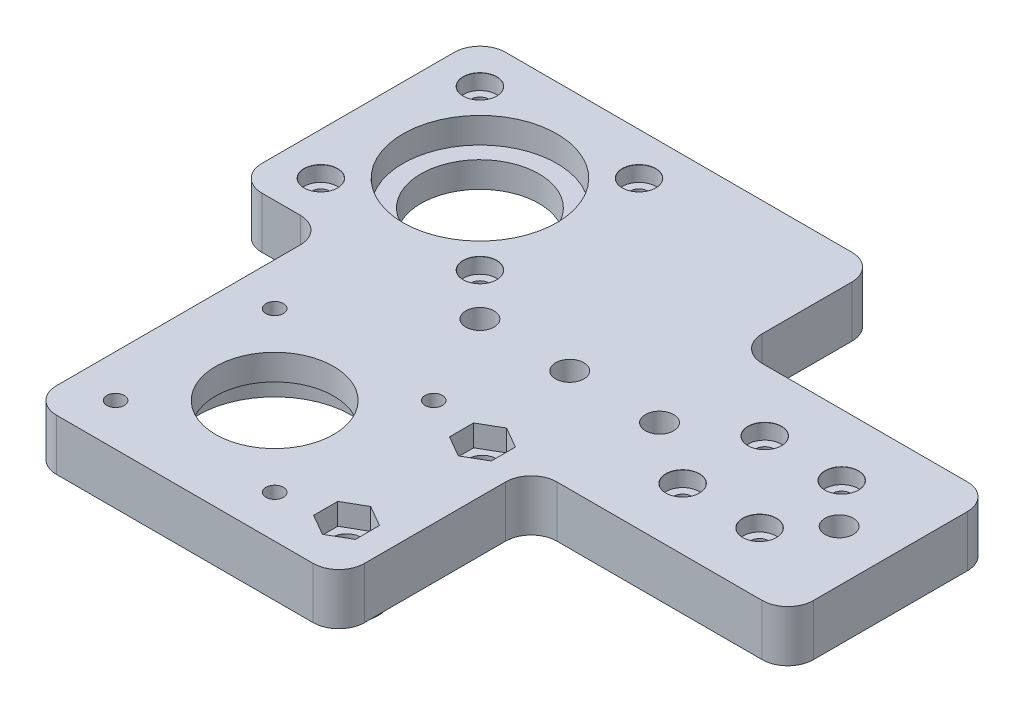
from build123d import *

# Parameters (mm, degrees)
BOSS_EXTRUDE1_DEPTH            = 10
FILLET1_R                      = 5
SKETCH3_R                      = 11.5
CUT_EXTRUDE1_DEPTH             = 10
CBORE_FOR_M3_SHCS1_AT_2_COUNT  = 2
CBORE_FOR_M3_SHCS1_AT_2_PITCH  = 43.840620434
CBORE_FOR_M3_SHCS1_AT_3_COUNT  = 2
CBORE_FOR_M3_SHCS1_AT_3_PITCH  = 31
CBORE_FOR_M3_SHCS1_AT_4_COUNT  = 2
CBORE_FOR_M3_SHCS1_AT_4_PITCH  = 31
CBORE_FOR_M3_SHCS2_AT_2_COUNT  = 2
CBORE_FOR_M3_SHCS2_AT_2_PITCH  = 15
CBORE_FOR_M3_SHCS2_AT_3_COUNT  = 2
CBORE_FOR_M3_SHCS2_AT_3_PITCH  = 21.931712199
CBORE_FOR_M3_SHCS2_AT_4_COUNT  = 2
CBORE_FOR_M3_SHCS2_AT_4_PITCH  = 16
CBORE_FOR_M5_SHCS1_AT_2_COUNT  = 2
CBORE_FOR_M5_SHCS1_AT_2_PITCH  = 35
CBORE_FOR_M5_SHCS1_AT_3_COUNT  = 2
CBORE_FOR_M5_SHCS1_AT_3_PITCH  = 52.5
CBORE_FOR_M5_SHCS1_AT_4_COUNT  = 2
CBORE_FOR_M5_SHCS1_AT_4_PITCH  = 70
BOSS_EXTRUDE2_DEPTH            = 10
CUT_EXTRUDE2_DEPTH             = 10
FILLET2_R                      = 5
SKETCH16_R                     = 11.5
CUT_EXTRUDE3_DEPTH             = 125.524094054
CBORE_FOR_M3_SHCS3_AT_2_COUNT  = 2
CBORE_FOR_M3_SHCS3_AT_2_PITCH  = 31
CBORE_FOR_M3_SHCS3_AT_3_COUNT  = 2
CBORE_FOR_M3_SHCS3_AT_3_PITCH  = 43.840620434
CBORE_FOR_M3_SHCS3_AT_4_COUNT  = 2
CBORE_FOR_M3_SHCS3_AT_4_PITCH  = 31
CUT_EXTRUDE4_DEPTH             = 4.2
M5_CLEARANCE_HOLE1_D           = 5.5
M5_CLEARANCE_HOLE1_CSINK_D     = 5.55
M5_CLEARANCE_HOLE1_CSINK_ANGLE = 90
SKETCH24_R                     = 15
CUT_EXTRUDE5_DEPTH             = 5
SKETCH25_R                     = 15
CUT_EXTRUDE6_DEPTH             = 5
BOSS_EXTRUDE3_START            = 2.9
SKETCH26_R                     = 6.25
SKETCH26_R_2                   = 2.75
BOSS_EXTRUDE3_DEPTH            = 2.9


with BuildPart() as part:
    # Sketch1 → Boss-Extrude1 (new body)
    with BuildSketch(Plane(origin=(0, 0, 0), x_dir=(1, 0, 0), z_dir=(0, 1, 0))):
        Polygon((0, 67.5), (0, -47.5), (60, -47.5), (60, -10), (110, -10), (110, 30), (60, 30), (60, 67.5), align=None)
    extrude(amount=BOSS_EXTRUDE1_DEPTH)

    # Fillet1
    fillet1_edges = [part.edges().sort_by_distance(p)[0] for p in [
        (60, 5, -30),
        (110, 5, -30),
        (110, 5, 10),
        (60, 5, 10),
        (0, 5, 47.5),
        (0, 5, -67.5),
        (60, 5, -67.5),
        (60, 5, 47.5),
    ]]
    fillet(fillet1_edges, radius=FILLET1_R)

    # Sketch3 → Cut-Extrude1 (cut)
    with BuildSketch(Plane(origin=(0, 10, 0), x_dir=(1, 0, 0), z_dir=(0, 1, 0))):
        with Locations((23.75, -23.75)):
            Circle(SKETCH3_R)
    extrude(amount=-CUT_EXTRUDE1_DEPTH, mode=Mode.SUBTRACT)

    # Sketch6 → CBORE for M3 SHCS1 (revolve, cut)
    with BuildSketch(Plane(origin=(39.25, 0, 8.25), x_dir=(0, 0, -1), z_dir=(1, 0, 0))):
        Polygon((0, 0), (0, 10), (1.7, 10), (1.7, 3), (3.25, 3), (3.25, 0.025), (3.275, 0), align=None)
    cbore_for_m3_shcs1 = revolve(axis=Axis((39.25, -6.35, 8.25), (0, 1, 0)), mode=Mode.SUBTRACT)

    # CBORE for M3 SHCS1 at 2: CBORE for M3 SHCS1 ×2
    with Locations(*[Vector(-0.7071067811865478, 0, 0.7071067811865474) * (i * CBORE_FOR_M3_SHCS1_AT_2_PITCH) for i in range(1, CBORE_FOR_M3_SHCS1_AT_2_COUNT)]):
        add(cbore_for_m3_shcs1, mode=Mode.SUBTRACT)

    # CBORE for M3 SHCS1 at 3: CBORE for M3 SHCS1 ×2
    with Locations(*[(-i * CBORE_FOR_M3_SHCS1_AT_3_PITCH, 0, 0) for i in range(1, CBORE_FOR_M3_SHCS1_AT_3_COUNT)]):
        add(cbore_for_m3_shcs1, mode=Mode.SUBTRACT)

    # CBORE for M3 SHCS1 at 4: CBORE for M3 SHCS1 ×2
    with Locations(*[(0, 0, i * CBORE_FOR_M3_SHCS1_AT_4_PITCH) for i in range(1, CBORE_FOR_M3_SHCS1_AT_4_COUNT)]):
        add(cbore_for_m3_shcs1, mode=Mode.SUBTRACT)

    # Sketch9 → CBORE for M3 SHCS2 (revolve, cut)
    with BuildSketch(Plane(origin=(77.5, 10, -18), x_dir=(0, 0, 1), z_dir=(1, 0, 0))):
        Polygon((0, 0), (0, 10), (1.7, 10), (1.7, 3), (3.25, 3), (3.25, 0.025), (3.275, 0), align=None)
    cbore_for_m3_shcs2 = revolve(axis=Axis((77.5, 16.35, -18), (0, -1, 0)), mode=Mode.SUBTRACT)

    # CBORE for M3 SHCS2 at 2: CBORE for M3 SHCS2 ×2
    with Locations(*[(i * CBORE_FOR_M3_SHCS2_AT_2_PITCH, 0, 0) for i in range(1, CBORE_FOR_M3_SHCS2_AT_2_COUNT)]):
        add(cbore_for_m3_shcs2, mode=Mode.SUBTRACT)

    # CBORE for M3 SHCS2 at 3: CBORE for M3 SHCS2 ×2
    with Locations(*[Vector(0.6839411288813299, 0, 0.729537204140085) * (i * CBORE_FOR_M3_SHCS2_AT_3_PITCH) for i in range(1, CBORE_FOR_M3_SHCS2_AT_3_COUNT)]):
        add(cbore_for_m3_shcs2, mode=Mode.SUBTRACT)

    # CBORE for M3 SHCS2 at 4: CBORE for M3 SHCS2 ×2
    with Locations(*[(0, 0, i * CBORE_FOR_M3_SHCS2_AT_4_PITCH) for i in range(1, CBORE_FOR_M3_SHCS2_AT_4_COUNT)]):
        add(cbore_for_m3_shcs2, mode=Mode.SUBTRACT)

    # Sketch12 → CBORE for M5 SHCS1 (revolve, cut)
    with BuildSketch(Plane(origin=(100, 0, -10), x_dir=(0, 0, -1), z_dir=(1, 0, 0))):
        Polygon((0, 0), (0, 10), (2.75, 10), (2.75, 5), (5, 5), (5, 0.025), (5.025, 0), align=None)
    cbore_for_m5_shcs1 = revolve(axis=Axis((100, -6.35, -10), (0, 1, 0)), mode=Mode.SUBTRACT)

    # CBORE for M5 SHCS1 at 2: CBORE for M5 SHCS1 ×2
    with Locations(*[(-i * CBORE_FOR_M5_SHCS1_AT_2_PITCH, 0, 0) for i in range(1, CBORE_FOR_M5_SHCS1_AT_2_COUNT)]):
        add(cbore_for_m5_shcs1, mode=Mode.SUBTRACT)

    # CBORE for M5 SHCS1 at 3: CBORE for M5 SHCS1 ×2
    with Locations(*[(-i * CBORE_FOR_M5_SHCS1_AT_3_PITCH, 0, 0) for i in range(1, CBORE_FOR_M5_SHCS1_AT_3_COUNT)]):
        add(cbore_for_m5_shcs1, mode=Mode.SUBTRACT)

    # CBORE for M5 SHCS1 at 4: CBORE for M5 SHCS1 ×2
    with Locations(*[(-i * CBORE_FOR_M5_SHCS1_AT_4_PITCH, 0, 0) for i in range(1, CBORE_FOR_M5_SHCS1_AT_4_COUNT)]):
        add(cbore_for_m5_shcs1, mode=Mode.SUBTRACT)

    # Sketch14 → Boss-Extrude2 (add)
    with BuildSketch(Plane(origin=(0, 10, 0), x_dir=(1, 0, 0), z_dir=(0, 1, 0))):
        with BuildLine():
            Line((0, 10), (-17.5, 10))
            Line((-17.5, 10), (-17.5, 67.5))
            Line((-17.5, 67.5), (5, 67.5))
            ThreePointArc((5, 67.5), (1.464466094, 66.035533906), (0, 62.5))
            Line((0, 62.5), (0, 10))
        make_face()
    extrude(amount=-BOSS_EXTRUDE2_DEPTH)

    # Sketch15 → Cut-Extrude2 (cut)
    with BuildSketch(Plane(origin=(0, 10, 0), x_dir=(1, 0, 0), z_dir=(0, 1, 0))):
        with BuildLine():
            Line((-17.5, 67.5), (55, 67.5))
            ThreePointArc((55, 67.5), (58.535533906, 66.035533906), (60, 62.5))
            Line((60, 62.5), (60, 57.5))
            Line((60, 57.5), (-17.5, 57.5))
            Line((-17.5, 57.5), (-17.5, 67.5))
        make_face()
    extrude(amount=-CUT_EXTRUDE2_DEPTH, mode=Mode.SUBTRACT)

    # Fillet2
    fillet2_edges = [part.edges().sort_by_distance(p)[0] for p in [
        (0, 5, -10),
        (60, 5, -57.5),
        (-17.5, 5, -57.5),
        (-17.5, 5, -10),
    ]]
    fillet(fillet2_edges, radius=FILLET2_R)

    # Sketch16 → Cut-Extrude3 (cut, through all)
    with BuildSketch(Plane(origin=(0, 10, 0), x_dir=(1, 0, 0), z_dir=(0, 1, 0))):
        with Locations((6.25, 33.75)):
            Circle(SKETCH16_R)
    extrude(amount=-CUT_EXTRUDE3_DEPTH, mode=Mode.SUBTRACT)

    # Sketch19 → CBORE for M3 SHCS3 (revolve, cut)
    with BuildSketch(Plane(origin=(-9.25, 10, -49.25), x_dir=(0, 0, 1), z_dir=(1, 0, 0))):
        Polygon((0, 0), (0, 10), (1.7, 10), (1.7, 3), (3.25, 3), (3.25, 0.025), (3.275, 0), align=None)
    cbore_for_m3_shcs3 = revolve(axis=Axis((-9.25, 16.35, -49.25), (0, -1, 0)), mode=Mode.SUBTRACT)

    # CBORE for M3 SHCS3 at 2: CBORE for M3 SHCS3 ×2
    with Locations(*[(i * CBORE_FOR_M3_SHCS3_AT_2_PITCH, 0, 0) for i in range(1, CBORE_FOR_M3_SHCS3_AT_2_COUNT)]):
        add(cbore_for_m3_shcs3, mode=Mode.SUBTRACT)

    # CBORE for M3 SHCS3 at 3: CBORE for M3 SHCS3 ×2
    with Locations(*[Vector(0.7071067811865476, 0, 0.7071067811865475) * (i * CBORE_FOR_M3_SHCS3_AT_3_PITCH) for i in range(1, CBORE_FOR_M3_SHCS3_AT_3_COUNT)]):
        add(cbore_for_m3_shcs3, mode=Mode.SUBTRACT)

    # CBORE for M3 SHCS3 at 4: CBORE for M3 SHCS3 ×2
    with Locations(*[(0, 0, i * CBORE_FOR_M3_SHCS3_AT_4_PITCH) for i in range(1, CBORE_FOR_M3_SHCS3_AT_4_COUNT)]):
        add(cbore_for_m3_shcs3, mode=Mode.SUBTRACT)

    # Sketch20 → Cut-Extrude4 (cut)
    with BuildSketch(Plane(origin=(0, 10, 0), x_dir=(1, 0, 0), z_dir=(0, 1, 0))):
        Polygon((55.070319398, -8.16), (51, -5.81), (46.929680602, -8.16), (46.929680602, -12.86), (51, -15.21), (55.070319398, -12.86), align=None)
        Polygon((51, -32.29), (46.929680602, -34.64), (46.929680602, -39.34), (51, -41.69), (55.070319398, -39.34), (55.070319398, -34.64), align=None)
    extrude(amount=-CUT_EXTRUDE4_DEPTH, mode=Mode.SUBTRACT)

    # M5 Clearance Hole1 (through all)
    with Locations(Plane(origin=(0, 10, 0), x_dir=(1, 0, 0), z_dir=(0, 1, 0))):
        with Locations((51, -10.51), (51, -36.99)):
            CounterSinkHole(M5_CLEARANCE_HOLE1_D / 2, M5_CLEARANCE_HOLE1_CSINK_D / 2, counter_sink_angle=M5_CLEARANCE_HOLE1_CSINK_ANGLE)

    # Sketch24 → Cut-Extrude5 (cut)
    with BuildSketch(Plane(origin=(0, 10, 0), x_dir=(1, 0, 0), z_dir=(0, 1, 0))):
        with Locations((6.25, 33.75)):
            Circle(SKETCH24_R)
    extrude(amount=-CUT_EXTRUDE5_DEPTH, mode=Mode.SUBTRACT)

    # Sketch25 → Cut-Extrude6 (cut)
    with BuildSketch(Plane.XZ):
        with Locations((23.75, 23.75)):
            Circle(SKETCH25_R)
    extrude(amount=-CUT_EXTRUDE6_DEPTH, mode=Mode.SUBTRACT)

    # Sketch26 → Boss-Extrude3 (add)
    # profile 1 of 2: a face of its own
    with BuildSketch(Plane.XZ.offset(BOSS_EXTRUDE3_START)):
        with Locations((51, 36.99)):
            Circle(SKETCH26_R)
        with Locations((51, 36.99)):
            Circle(SKETCH26_R_2, mode=Mode.SUBTRACT)
    # profile 2 of 2: a face of its own
    with BuildSketch(Plane.XZ.offset(BOSS_EXTRUDE3_START)):
        with Locations((51, 10.51)):
            Circle(SKETCH26_R)
        with Locations((51, 10.51)):
            Circle(SKETCH26_R_2, mode=Mode.SUBTRACT)
    extrude(amount=-BOSS_EXTRUDE3_DEPTH)


solid = part.part
